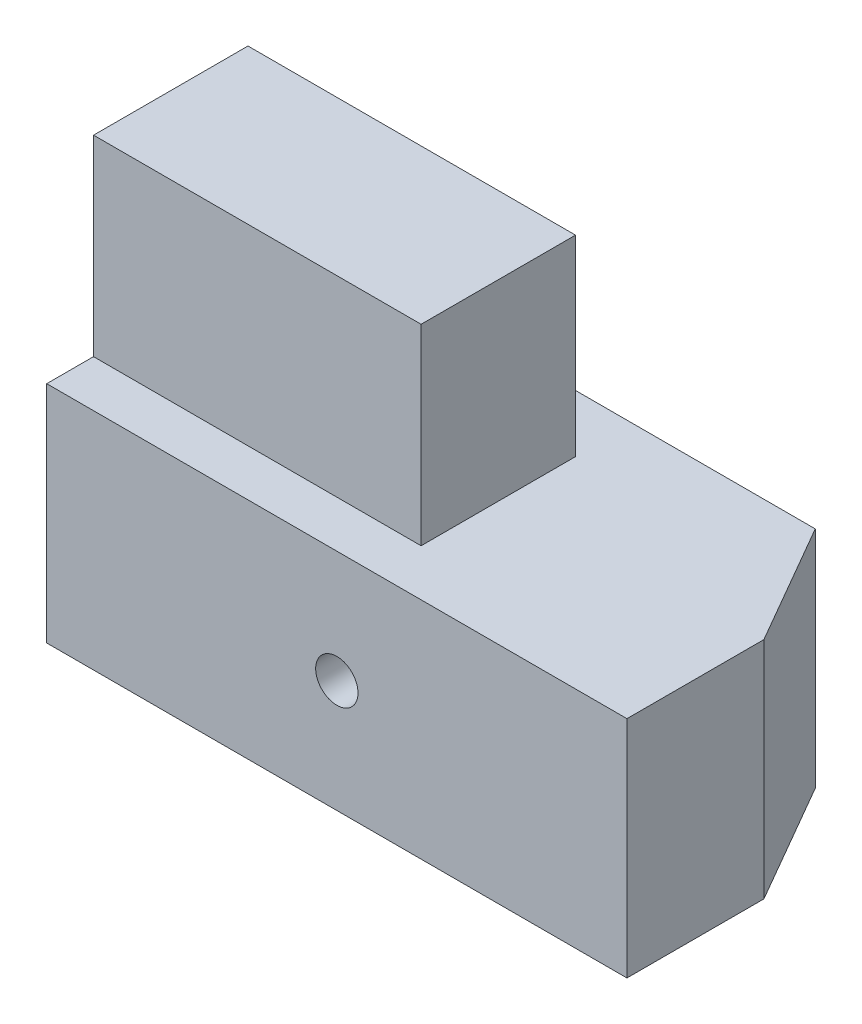
from build123d import *

# Parameters (mm, degrees)
SKETCH1_W           = 124
SKETCH1_H           = 48
SKETCH1_R           = 4.525
BOSS_EXTRUDE1_DEPTH = 55.25
SKETCH2_W           = 70
SKETCH2_H           = 33
BOSS_EXTRUDE2_DEPTH = 41
CHAMFER1_SIZE       = 15
CHAMFER1_SIZE2      = 25.980762114


with BuildPart() as part:
    # Sketch1 → Boss-Extrude1 (new body)
    with BuildSketch(Plane.XY):
        Rectangle(SKETCH1_W, SKETCH1_H)
        Circle(SKETCH1_R, mode=Mode.SUBTRACT)
    extrude(amount=-BOSS_EXTRUDE1_DEPTH)

    # Sketch2 → Boss-Extrude2 (add)
    with BuildSketch(Plane(origin=(0, 24, 0), x_dir=(1, 0, 0), z_dir=(0, 1, 0))):
        with Locations((-26.99, 26.5)):
            Rectangle(SKETCH2_W, SKETCH2_H)
    extrude(amount=BOSS_EXTRUDE2_DEPTH)

    # Chamfer1
    chamfer1_edges = [part.edges().sort_by_distance(p)[0] for p in [
        (62, 0, -55.25),
    ]]
    chamfer1_side = [part.faces().sort_by_distance(p)[0] for p in [
        (0, 22.670338389, -55.25),
    ]]
    chamfer(chamfer1_edges, length=CHAMFER1_SIZE, length2=CHAMFER1_SIZE2, reference=chamfer1_side[0])


solid = part.part
